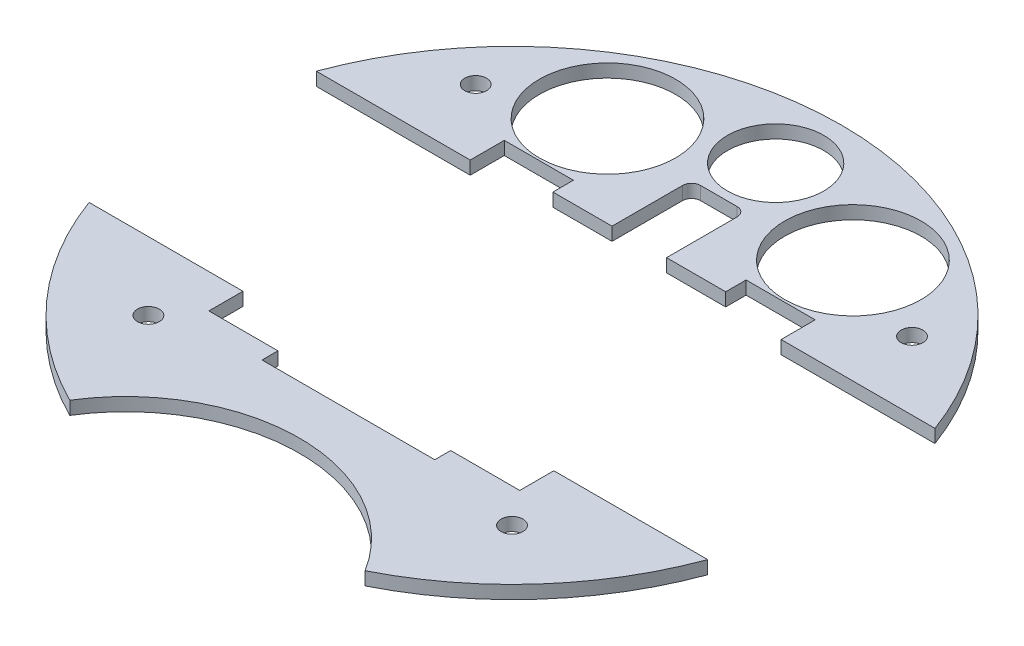
from build123d import *

# Parameters (mm, degrees)
BOSS_EXTRUDE1_DEPTH  = 2.9
SOLENOID_PLACEMENT_W = 38
SOLENOID_PLACEMENT_H = 64
CUT_EXTRUDE1_DEPTH   = 103.571487266
SKETCH7_R            = 15
CUT_EXTRUDE6_DEPTH   = 103.571487266
SKETCH8_R            = 2.4
CUT_EXTRUDE7_DEPTH   = 103.571487266
CUT_EXTRUDE3_DEPTH   = 103.571487266
CUT_EXTRUDE8_DEPTH   = 100.478188564
SKETCH10_R           = 10.605
CUT_EXTRUDE9_DEPTH   = 100.478188564


with BuildPart() as part:
    # Sketch1 → Boss-Extrude1 (new body)
    with BuildSketch(Plane(origin=(0, 0, 0), x_dir=(1, 0, 0), z_dir=(0, 1, 0))):
        with BuildLine():
            ThreePointArc((32.48910875, -64.812867647), (0, 72.5), (-32.48910875, -64.812867647))
            ThreePointArc((-32.48910875, -64.812867647), (0, -46.75), (32.48910875, -64.812867647))
        make_face()
    extrude(amount=BOSS_EXTRUDE1_DEPTH)

    # solenoid placement → Cut-Extrude1 (cut, through all)
    with BuildSketch(Plane(origin=(0, 2.9, 0), x_dir=(1, 0, 0), z_dir=(0, 1, 0))):
        with Locations((0, -4)):
            Rectangle(SOLENOID_PLACEMENT_W, SOLENOID_PLACEMENT_H)
    extrude(amount=-CUT_EXTRUDE1_DEPTH, mode=Mode.SUBTRACT)

    # Sketch7 → Cut-Extrude6 (cut, through all)
    with BuildSketch(Plane(origin=(0, 2.9, 0), x_dir=(1, 0, 0), z_dir=(0, 1, 0))):
        with Locations((27, 48)):
            Circle(SKETCH7_R)
        with Locations((-27, 48)):
            Circle(SKETCH7_R)
    extrude(amount=-CUT_EXTRUDE6_DEPTH, mode=Mode.SUBTRACT)

    # Sketch8 → Cut-Extrude7 (cut, through all)
    with BuildSketch(Plane(origin=(0, 2.9, 0), x_dir=(1, 0, 0), z_dir=(0, 1, 0))):
        with Locations((40, -40)):
            Circle(SKETCH8_R)
        with Locations((-40, -40)):
            Circle(SKETCH8_R)
        with Locations((48, 40)):
            Circle(SKETCH8_R)
        with Locations((-48, 40)):
            Circle(SKETCH8_R)
    extrude(amount=-CUT_EXTRUDE7_DEPTH, mode=Mode.SUBTRACT)

    # Sketch3 → Cut-Extrude3 (cut, through all)
    with BuildSketch(Plane(origin=(0, 2.9, 0), x_dir=(1, 0, 0), z_dir=(0, 1, 0))):
        with BuildLine():
            Line((-34.2, -32.5), (-22.2, -32.5))
            Line((-22.2, -32.5), (-19, -32.5))
            Line((-19, -32.5), (-19, 32.5))
            Line((-19, 32.5), (-22.2, 32.5))
            Line((-22.2, 32.5), (-34.2, 32.5))
            Line((-34.2, 32.5), (-34.2, 25))
            Line((-34.2, 25), (-68.053287944, 25))
            ThreePointArc((-68.053287944, 25), (-72.5, 0), (-68.053287944, -25))
            Line((-68.053287944, -25), (-34.2, -25))
            Line((-34.2, -25), (-34.2, -32.5))
        make_face()
        with BuildLine():
            Line((19, 32.5), (19, -32.5))
            Line((19, -32.5), (22.2, -32.5))
            Line((22.2, -32.5), (34.2, -32.5))
            Line((34.2, -32.5), (34.2, -25))
            Line((34.2, -25), (68.053287944, -25))
            ThreePointArc((68.053287944, -25), (72.5, 0), (68.053287944, 25))
            Line((68.053287944, 25), (34.2, 25))
            Line((34.2, 25), (34.2, 32.5))
            Line((34.2, 32.5), (22.2, 32.5))
            Line((22.2, 32.5), (19, 32.5))
        make_face()
    extrude(amount=-CUT_EXTRUDE3_DEPTH, mode=Mode.SUBTRACT)


with BuildPart() as cut_extrude3_piece_1:
    # of the separate pieces the step leaves, piece 1, a body of its own (cut_extrude3_pieces)
    add(part.part.solids().sort_by_distance((68.053287944, 0, -25))[0])

    # Sketch9 → Cut-Extrude8 (cut, through all)
    with BuildSketch(Plane(origin=(0, 2.9, 0), x_dir=(1, 0, 0), z_dir=(0, 1, 0))):
        with BuildLine():
            Line((6, 43.5), (6, 28))
            Line((6, 28), (-6, 28))
            Line((-6, 28), (-6, 43.5))
            ThreePointArc((-6, 43.5), (-5.414213562, 44.914213562), (-4, 45.5))
            Line((-4, 45.5), (4, 45.5))
            ThreePointArc((4, 45.5), (5.414213562, 44.914213562), (6, 43.5))
        make_face()
    extrude(amount=-CUT_EXTRUDE8_DEPTH, mode=Mode.SUBTRACT)

    # Sketch10 → Cut-Extrude9 (cut, through all)
    with BuildSketch(Plane(origin=(0, 2.9, 0), x_dir=(1, 0, 0), z_dir=(0, 1, 0))):
        with Locations((0, 58)):
            Circle(SKETCH10_R)
    extrude(amount=-CUT_EXTRUDE9_DEPTH, mode=Mode.SUBTRACT)


with BuildPart() as cut_extrude3_piece_2:
    # of the separate pieces the step leaves, piece 2, a body of its own (cut_extrude3_pieces)
    add(part.part.solids().sort_by_distance((32.48910875, 0, 64.812867647))[0])


solid = Compound([cut_extrude3_piece_1.part, cut_extrude3_piece_2.part])
